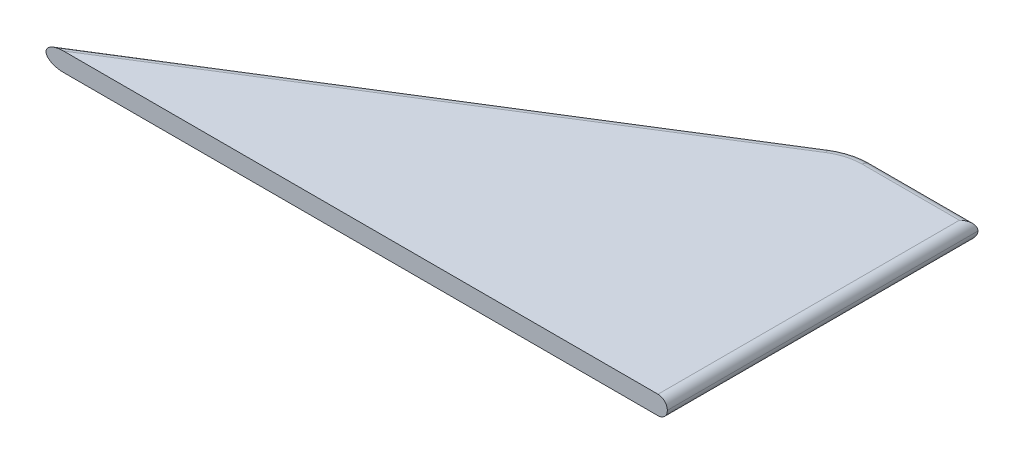
from build123d import *

# Parameters (mm, degrees)
BOSS_EXTRUDE1_DEPTH = 3
FILLET1_R           = 10
FILLET2_R           = 1.5


with BuildPart() as part:
    # Sketch1 → Boss-Extrude1 (new body)
    with BuildSketch(Plane(origin=(0, 0, 0), x_dir=(1, 0, 0), z_dir=(0, 1, 0))):
        Polygon((0, 0), (100, 0), (100, 50), (80, 50), align=None)
    extrude(amount=BOSS_EXTRUDE1_DEPTH)

    # Fillet1
    fillet1_edges = [part.edges().sort_by_distance(p)[0] for p in [
        (80, 1.5, -50),
    ]]
    fillet(fillet1_edges, radius=FILLET1_R)

    # Fillet2
    fillet2_edges = [part.edges().sort_by_distance(p)[0] for p in [
        (91.433981132, 0, -50),
        (80.111137134, 0, -49.612487462),
        (91.433981132, 3, -50),
        (80.111137134, 3, -49.612487462),
        (100, 3, -25),
        (100, 0, -25),
        (38.783986432, 0, -24.23999152),
        (38.783986432, 3, -24.23999152),
    ]]
    fillet(fillet2_edges, radius=FILLET2_R - 0.0001)  # a hair under: the kernel refuses the full size


solid = part.part
